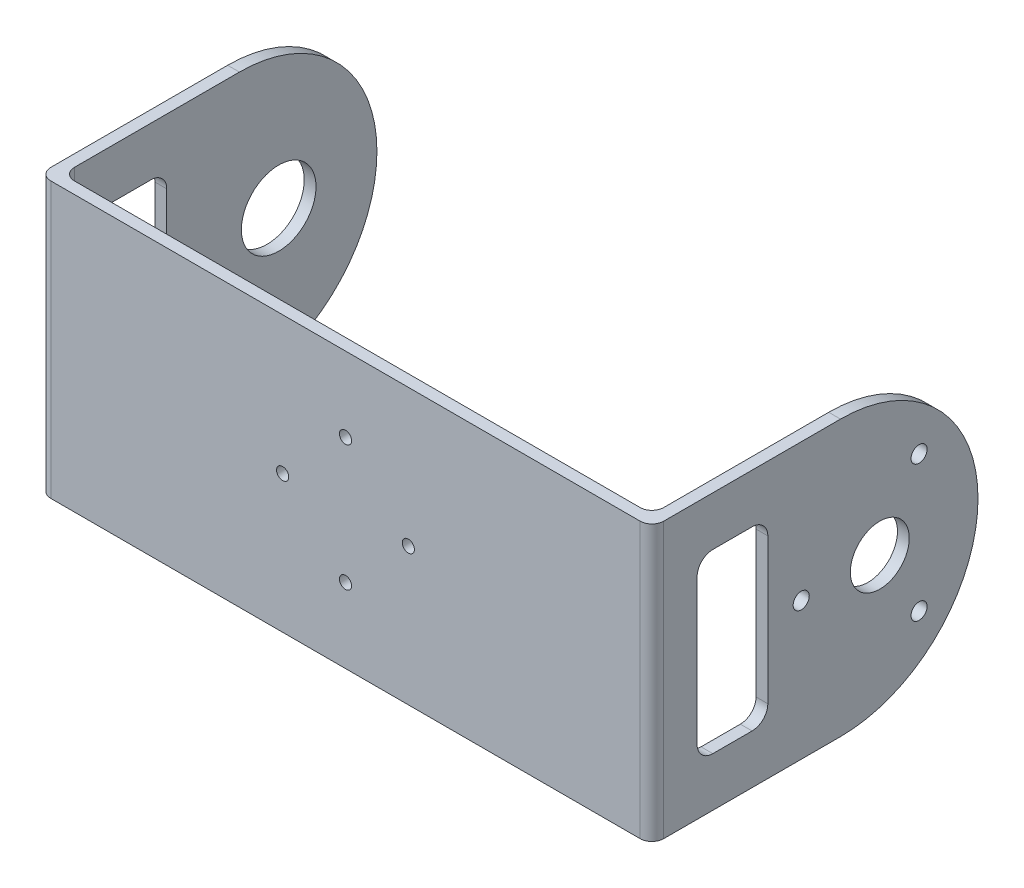
from build123d import *

# Parameters (mm, degrees)
EXTRUDE_1_DEPTH       = 70
FILLET_1_R            = 3
SKETCH_4_R            = 1.55
CUT_EXTRUDE_3_1_DEPTH = 70
SKETCH_13_R           = 2.05
SKETCH_13_R_2         = 7.5
CUT_EXTRUDE_8_DEPTH   = 10
FILLET_6_R            = 35
SKETCH_14_R           = 9.5
CUT_EXTRUDE_9_DEPTH   = 10
SKETCH_15_W           = 18
SKETCH_15_H           = 45
CUT_EXTRUDE_11_DEPTH  = 189.774998345
FILLET_7_R            = 4


with BuildPart() as part:
    # 草图1 → 凸台-拉伸1 (new body)
    with BuildSketch(Plane(origin=(0, 0, 0), x_dir=(1, 0, 0), z_dir=(0, 1, 0))):
        Polygon((-75, 0), (75, 0), (75, 80), (78, 80), (78, -3), (-78, -3), (-78, 80), (-75, 80), align=None)
    extrude(amount=EXTRUDE_1_DEPTH)

    # 圆角1
    fillet_1_edges = [part.edges().sort_by_distance(p)[0] for p in [
        (78, 35, 3),
        (-78, 35, 3),
        (-75, 35, 0),
        (75, 35, 0),
    ]]
    fillet(fillet_1_edges, radius=FILLET_1_R)

    # 草图4 → φ3.1通孔 (cut)
    with BuildSketch(Plane(origin=(0, 0, 0), x_dir=(-1, 0, 0), z_dir=(0, 0, -1))):
        with Locations((0, 51)):
            Circle(SKETCH_4_R)
        with Locations((16, 35)):
            Circle(SKETCH_4_R)
        with Locations((0, 19)):
            Circle(SKETCH_4_R)
        with Locations((-16, 35)):
            Circle(SKETCH_4_R)
    extrude(amount=-CUT_EXTRUDE_3_1_DEPTH, mode=Mode.SUBTRACT)

    # 草图13 → 切除-拉伸8 (cut)
    with BuildSketch(Plane(origin=(78, 0, 0), x_dir=(0, 0, -1), z_dir=(1, 0, 0))):
        with Locations((35, 35)):
            Circle(SKETCH_13_R)
        with Locations((65, 52.320508076)):
            Circle(SKETCH_13_R)
        with Locations((65, 17.679491924)):
            Circle(SKETCH_13_R)
        with Locations((55, 35)):
            Circle(SKETCH_13_R_2)
    extrude(amount=-CUT_EXTRUDE_8_DEPTH, mode=Mode.SUBTRACT)

    # 圆角6
    fillet_6_edges = [part.edges().sort_by_distance(p)[0] for p in [
        (-76.5, 70, -80),
        (-76.5, 0, -80),
        (76.5, 70, -80),
        (76.5, 0, -80),
    ]]
    fillet(fillet_6_edges, radius=FILLET_6_R - 0.0001)  # a hair under: the kernel refuses the full size

    # 草图14 → 切除-拉伸9 (cut)
    with BuildSketch(Plane.ZY.offset(78)):
        with Locations((-55, 35)):
            Circle(SKETCH_14_R)
    extrude(amount=-CUT_EXTRUDE_9_DEPTH, mode=Mode.SUBTRACT)

    # 草图15 → 切除-拉伸11 (cut, through all)
    with BuildSketch(Plane(origin=(78, 0, 0), x_dir=(0, 0, -1), z_dir=(1, 0, 0))):
        with Locations((17.5, 35)):
            Rectangle(SKETCH_15_W, SKETCH_15_H)
    extrude(amount=-CUT_EXTRUDE_11_DEPTH, mode=Mode.SUBTRACT)

    # 圆角7
    fillet_7_edges = [part.edges().sort_by_distance(p)[0] for p in [
        (76.5, 57.5, -26.5),
        (-76.5, 57.5, -26.5),
        (76.5, 12.5, -26.5),
        (-76.5, 12.5, -26.5),
        (76.5, 12.5, -8.5),
        (-76.5, 12.5, -8.5),
        (76.5, 57.5, -8.5),
        (-76.5, 57.5, -8.5),
    ]]
    fillet(fillet_7_edges, radius=FILLET_7_R)


solid = part.part
